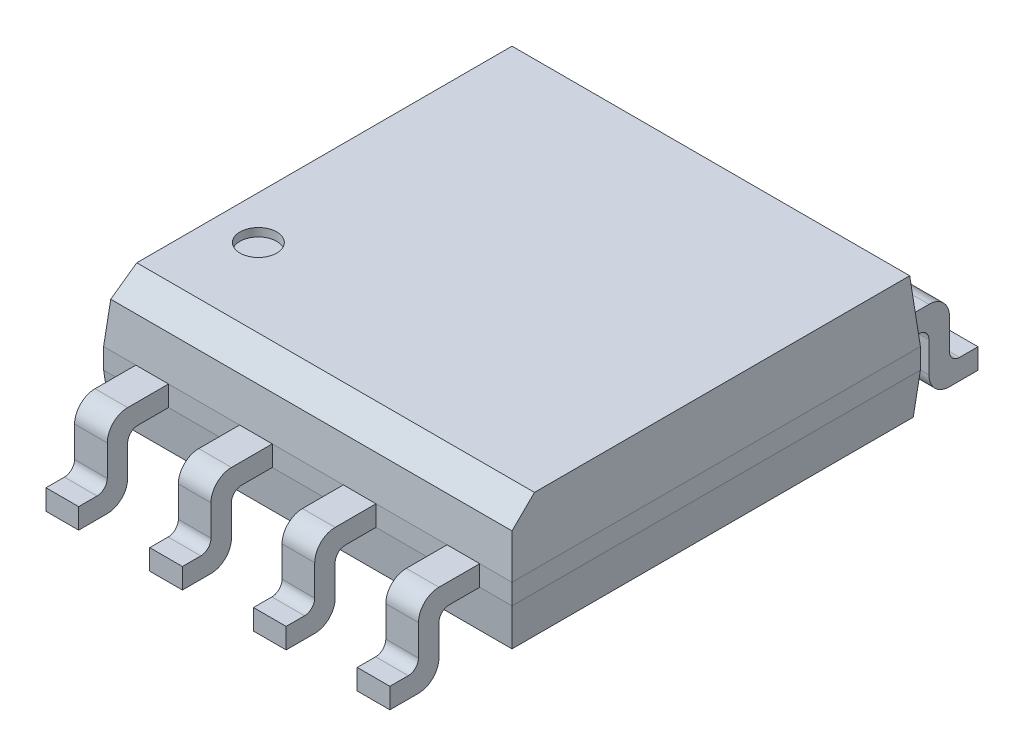
from build123d import *

# Parameters (mm, degrees)
SKETCH2_W            = 5
SKETCH2_H            = 5
PACKAGE_DEPTH        = 1.5
DRAFT1_START         = -2.5
DRAFT1_DEPTH         = 5
DRAFT1_START_2       = -3
DRAFT1_2_DEPTH       = 6
DRAFT2_START         = -2.5
DRAFT2_DEPTH         = 5
DRAFT2_START_2       = -3
DRAFT2_2_DEPTH       = 6
CHAMFER1_SIZE        = 0.25
CHAMFER1_SIZE2       = 0.275015717
LEADS_DEPTH          = 0.2
FILLET1_R            = 0.25
FILLET2_R            = 0.125
FILLET1_OF_MIRROR1_R = 0.25
FILLET2_OF_MIRROR1_R = 0.125
LPATTERN1_START      = -0.835
LPATTERN1_DEPTH      = 0.4
LPATTERN1_START_2    = 0.435
LPATTERN1_2_DEPTH    = 0.4
LPATTERN1_START_3    = 1.705
LPATTERN1_3_DEPTH    = 0.4
SKETCH4_R            = 0.225
MARKER_DEPTH         = 0.1


with BuildPart() as part:
    # Sketch2 → Package (new body)
    with BuildSketch(Plane(origin=(0, 0.25, 0), x_dir=(-1, 0, 0), z_dir=(0, 1, 0))):
        Rectangle(SKETCH2_W, SKETCH2_H)
    extrude(amount=PACKAGE_DEPTH)

    # Draft1: read off the stored shape, not the designer's step
    # Draft1 outline → Draft1 (cut)
    with BuildSketch(Plane.YZ.offset(DRAFT1_START)):
        Polygon((1.75, -2.5), (1.75, -2.434383502), (1, -2.5), align=None)
        Polygon((1, 2.5), (1.75, 2.434383502), (1.75, 2.5), align=None)
    extrude(amount=DRAFT1_DEPTH, mode=Mode.SUBTRACT)

    # Draft1 2 outline → Draft1 2 (cut)
    with BuildSketch(Plane.XY.offset(DRAFT1_START_2)):
        Polygon((-2.5, 1), (-2.434383502, 1.75), (-2.5, 1.75), align=None)
        Polygon((2.434383502, 1.75), (2.5, 1), (2.5, 1.75), align=None)
    extrude(amount=DRAFT1_2_DEPTH, mode=Mode.SUBTRACT)

    # Draft2: read off the stored shape, not the designer's step
    # Draft2 outline → Draft2 (cut)
    with BuildSketch(Plane.XY.offset(DRAFT2_START)):
        Polygon((2.5, 0.75), (2.456255668, 0.25), (2.5, 0.25), align=None)
        Polygon((-2.456255668, 0.25), (-2.5, 0.75), (-2.5, 0.25), align=None)
    extrude(amount=DRAFT2_DEPTH, mode=Mode.SUBTRACT)

    # Draft2 2 outline → Draft2 2 (cut)
    with BuildSketch(Plane.YZ.offset(DRAFT2_START_2)):
        Polygon((0.75, -2.5), (0.25, -2.456255668), (0.25, -2.5), align=None)
        Polygon((0.25, 2.456255668), (0.75, 2.5), (0.25, 2.5), align=None)
    extrude(amount=DRAFT2_2_DEPTH, mode=Mode.SUBTRACT)

    # Chamfer1
    chamfer1_edges = [part.edges().sort_by_distance(p)[0] for p in [
        (0, 1.75, 2.434383502),
    ]]
    chamfer1_side = [part.faces().sort_by_distance(p)[0] for p in [
        (0, 1.373337774, 2.467337177),
    ]]
    chamfer(chamfer1_edges, length=CHAMFER1_SIZE, length2=CHAMFER1_SIZE2, reference=chamfer1_side[0])

    # Sketch3 → Leads (add, symmetric)
    with BuildSketch(Plane.ZY.offset(1.905)):
        Polygon((-2.5, 1), (-2.5, 0.75), (3, 0.75), (3, 0), (3.6, 0), (3.6, 0.25), (3.25, 0.25), (3.25, 1), align=None)
    leads = extrude(amount=LEADS_DEPTH, both=True)

    # Fillet1
    fillet1_edges = [part.edges().sort_by_distance(p)[0] for p in [
        (-1.905, 1, 3.25),
        (-1.905, 0, 3),
    ]]
    fillet(fillet1_edges, radius=FILLET1_R)

    # Fillet2
    fillet2_edges = [part.edges().sort_by_distance(p)[0] for p in [
        (-1.905, 0.75, 3),
        (-1.905, 0.25, 3.25),
    ]]
    fillet(fillet2_edges, radius=FILLET2_R)

    # Mirror1: Leads across plane
    add(leads.mirror(Plane.XY))

    # Fillet1 of Mirror1
    fillet1_of_mirror1_edges = [part.edges().sort_by_distance(p)[0] for p in [
        (-1.905, 1, -3.25),
        (-1.905, 0, -3),
    ]]
    fillet(fillet1_of_mirror1_edges, radius=FILLET1_OF_MIRROR1_R)

    # Fillet2 of Mirror1
    fillet2_of_mirror1_edges = [part.edges().sort_by_distance(p)[0] for p in [
        (-1.905, 0.75, -3),
        (-1.905, 0.25, -3.25),
    ]]
    fillet(fillet2_of_mirror1_edges, radius=FILLET2_OF_MIRROR1_R)

    # LPattern1: read off the stored shape, not the designer's step
    # LPattern1 outline → LPattern1 (add)
    with BuildSketch(Plane.YZ.offset(LPATTERN1_START)):
        with BuildLine():
            Line((1, 2.5), (1, 3))
            ThreePointArc((1, 3), (0.926776695, 3.176776695), (0.75, 3.25))
            Line((0.75, 3.25), (0.375, 3.25))
            ThreePointArc((0.375, 3.25), (0.286611652, 3.286611652), (0.25, 3.375))
            Line((0.25, 3.375), (0.25, 3.6))
            Line((0.25, 3.6), (0, 3.6))
            Line((0, 3.6), (0, 3.25))
            ThreePointArc((0, 3.25), (0.073223305, 3.073223305), (0.25, 3))
            Line((0.25, 3), (0.625, 3))
            ThreePointArc((0.625, 3), (0.713388348, 2.963388348), (0.75, 2.875))
            Line((0.75, 2.875), (0.75, 2.5))
            Line((0.75, 2.5), (1, 2.5))
        make_face()
        with BuildLine():
            ThreePointArc((0.75, -3.25), (0.926776695, -3.176776695), (1, -3))
            Line((1, -3), (1, -2.5))
            Line((1, -2.5), (0.75, -2.5))
            Line((0.75, -2.5), (0.75, -2.875))
            ThreePointArc((0.75, -2.875), (0.713388348, -2.963388348), (0.625, -3))
            Line((0.625, -3), (0.25, -3))
            ThreePointArc((0.25, -3), (0.073223305, -3.073223305), (0, -3.25))
            Line((0, -3.25), (0, -3.6))
            Line((0, -3.6), (0.25, -3.6))
            Line((0.25, -3.6), (0.25, -3.375))
            ThreePointArc((0.25, -3.375), (0.286611652, -3.286611652), (0.375, -3.25))
            Line((0.375, -3.25), (0.75, -3.25))
        make_face()
    extrude(amount=LPATTERN1_DEPTH)

    # LPattern1 2 outline → LPattern1 2 (add)
    with BuildSketch(Plane.YZ.offset(LPATTERN1_START_2)):
        with BuildLine():
            Line((1, 2.5), (1, 3))
            ThreePointArc((1, 3), (0.926776695, 3.176776695), (0.75, 3.25))
            Line((0.75, 3.25), (0.375, 3.25))
            ThreePointArc((0.375, 3.25), (0.286611652, 3.286611652), (0.25, 3.375))
            Line((0.25, 3.375), (0.25, 3.6))
            Line((0.25, 3.6), (0, 3.6))
            Line((0, 3.6), (0, 3.25))
            ThreePointArc((0, 3.25), (0.073223305, 3.073223305), (0.25, 3))
            Line((0.25, 3), (0.625, 3))
            ThreePointArc((0.625, 3), (0.713388348, 2.963388348), (0.75, 2.875))
            Line((0.75, 2.875), (0.75, 2.5))
            Line((0.75, 2.5), (1, 2.5))
        make_face()
        with BuildLine():
            ThreePointArc((0.75, -3.25), (0.926776695, -3.176776695), (1, -3))
            Line((1, -3), (1, -2.5))
            Line((1, -2.5), (0.75, -2.5))
            Line((0.75, -2.5), (0.75, -2.875))
            ThreePointArc((0.75, -2.875), (0.713388348, -2.963388348), (0.625, -3))
            Line((0.625, -3), (0.25, -3))
            ThreePointArc((0.25, -3), (0.073223305, -3.073223305), (0, -3.25))
            Line((0, -3.25), (0, -3.6))
            Line((0, -3.6), (0.25, -3.6))
            Line((0.25, -3.6), (0.25, -3.375))
            ThreePointArc((0.25, -3.375), (0.286611652, -3.286611652), (0.375, -3.25))
            Line((0.375, -3.25), (0.75, -3.25))
        make_face()
    extrude(amount=LPATTERN1_2_DEPTH)

    # LPattern1 3 outline → LPattern1 3 (add)
    with BuildSketch(Plane.YZ.offset(LPATTERN1_START_3)):
        with BuildLine():
            Line((1, 2.5), (1, 3))
            ThreePointArc((1, 3), (0.926776695, 3.176776695), (0.75, 3.25))
            Line((0.75, 3.25), (0.375, 3.25))
            ThreePointArc((0.375, 3.25), (0.286611652, 3.286611652), (0.25, 3.375))
            Line((0.25, 3.375), (0.25, 3.6))
            Line((0.25, 3.6), (0, 3.6))
            Line((0, 3.6), (0, 3.25))
            ThreePointArc((0, 3.25), (0.073223305, 3.073223305), (0.25, 3))
            Line((0.25, 3), (0.625, 3))
            ThreePointArc((0.625, 3), (0.713388348, 2.963388348), (0.75, 2.875))
            Line((0.75, 2.875), (0.75, 2.5))
            Line((0.75, 2.5), (1, 2.5))
        make_face()
        with BuildLine():
            ThreePointArc((0.75, -3.25), (0.926776695, -3.176776695), (1, -3))
            Line((1, -3), (1, -2.5))
            Line((1, -2.5), (0.75, -2.5))
            Line((0.75, -2.5), (0.75, -2.875))
            ThreePointArc((0.75, -2.875), (0.713388348, -2.963388348), (0.625, -3))
            Line((0.625, -3), (0.25, -3))
            ThreePointArc((0.25, -3), (0.073223305, -3.073223305), (0, -3.25))
            Line((0, -3.25), (0, -3.6))
            Line((0, -3.6), (0.25, -3.6))
            Line((0.25, -3.6), (0.25, -3.375))
            ThreePointArc((0.25, -3.375), (0.286611652, -3.286611652), (0.375, -3.25))
            Line((0.375, -3.25), (0.75, -3.25))
        make_face()
    extrude(amount=LPATTERN1_3_DEPTH)

    # Sketch4 → Marker (cut)
    with BuildSketch(Plane(origin=(0, 1.75, 0), x_dir=(1, 0, 0), z_dir=(0, 1, 0))):
        with Locations(Location((-1.905, -1.2, 0), (0, 0, 270))):
            Circle(SKETCH4_R)
    extrude(amount=-MARKER_DEPTH, mode=Mode.SUBTRACT)


solid = part.part
